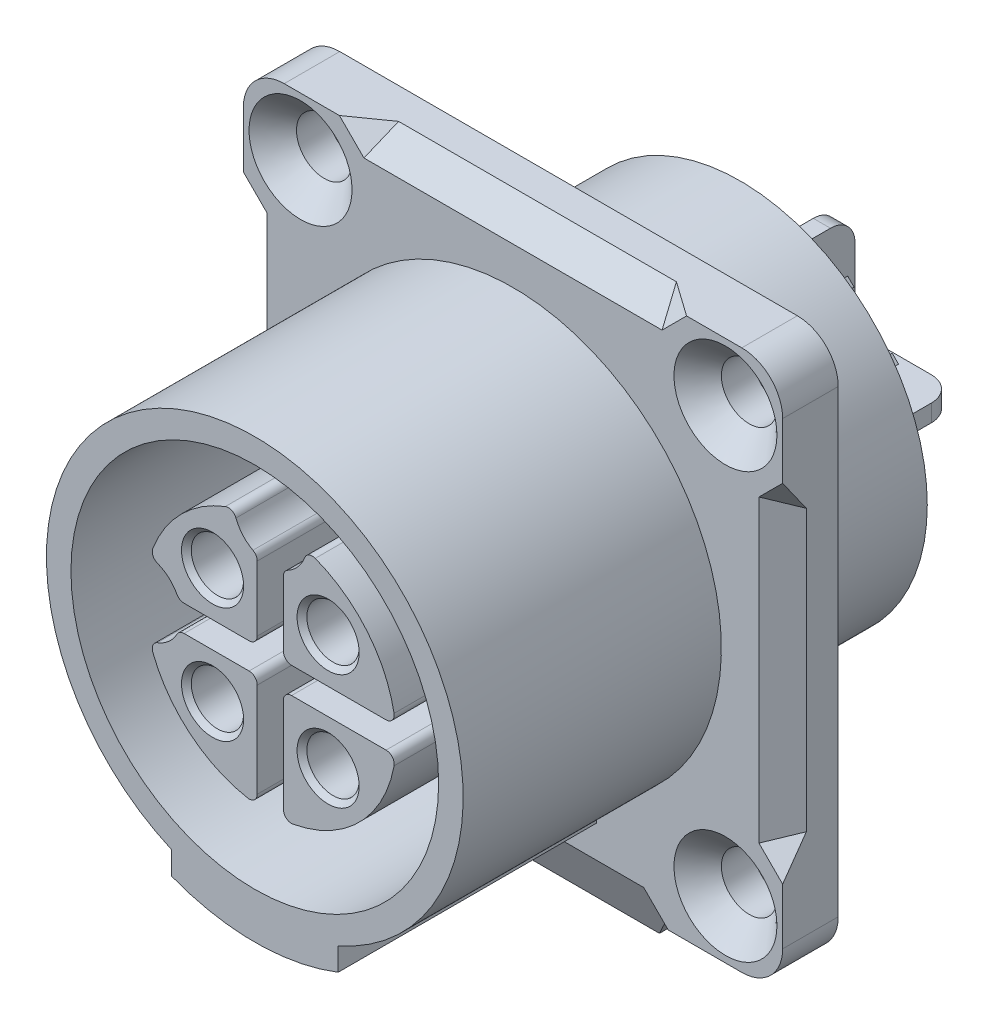
from build123d import *

# Parameters (mm, degrees)
BOSS_EXTRUDE1_DEPTH                             = 3.4
SKETCH2_R                                       = 11.25
BOSS_EXTRUDE2_DEPTH                             = 15.8
SKETCH3_R                                       = 1.6
BOSS_EXTRUDE3_DEPTH                             = 14.85
CHAMFER1_SIZE                                   = 0.3
FILLET1_R                                       = 0.5
SKETCH4_W                                       = 7.55
SKETCH4_H                                       = 14
SKETCH4_W_2                                     = 1.45
SKETCH4_W_3                                     = 14
SKETCH4_H_2                                     = 1.5
SKETCH4_H_3                                     = 7.5
CUT_EXTRUDE1_DEPTH                              = 1.5
CUT_EXTRUDE2_START                              = 1.1
CUT_EXTRUDE2_DEPTH                              = 2.3
CHAMFER2_SIZE                                   = 1.5
CHAMFER4_SIZE                                   = 1.5
CHAMFER6_SIZE                                   = 2.3
CHAMFER3_SIZE                                   = 1.5
CHAMFER5_SIZE                                   = 2.3
CHAMFER5_SIZE_2                                 = 4.32567087
CSK_FOR_M3_FLAT_HEAD_MACHINE_SCREW1_D           = 3.4
CSK_FOR_M3_FLAT_HEAD_MACHINE_SCREW1_CSINK_D     = 6.3
CSK_FOR_M3_FLAT_HEAD_MACHINE_SCREW1_CSINK_ANGLE = 90
FILLET2_R                                       = 2.5
SKETCH8_R                                       = 11.45
SKETCH8_R_2                                     = 10.25
BOSS_EXTRUDE4_DEPTH                             = 10.5
SKETCH9_R                                       = 10.25
BOSS_EXTRUDE5_DEPTH                             = 6.6
SKETCH10_R                                      = 7.75
BOSS_EXTRUDE6_DEPTH                             = 1.1
SKETCH11_W                                      = 1.05
SKETCH11_H                                      = 13.4
SKETCH11_W_2                                    = 13.4
SKETCH11_H_2                                    = 1.05
EXTRUDE_THIN1_DEPTH                             = 9.3
FILLET3_R                                       = 1.5
SKETCH12_R                                      = 2.2
SKETCH12_R_2                                    = 1.65
BOSS_EXTRUDE7_DEPTH                             = 7.4
CIRPATTERN1_COUNT                               = 4


# Read off the part's stored shape, not the designer's step: Cut-Extrude2
# Some blends are built 0.0001 mm under size
with BuildPart() as part:
    # Sketch1 → Boss-Extrude1 (new body)
    with BuildSketch(Plane.XY):
        Polygon((8.75, -16.55), (6.75, -19.21), (-6.75, -19.21), (-8.75, -16.55), (-16.5, -16.55), (-16.5, 16.55), (16.5, 16.55), (16.5, -16.55), align=None)
    extrude(amount=BOSS_EXTRUDE1_DEPTH)

    # Sketch2 → Boss-Extrude2 (add)
    with BuildSketch(Plane.XY.offset(3.4)):
        with BuildLine():
            Line((5.1, -13.091695841), (5.1, -11.685568022))
            ThreePointArc((5.1, -11.685568022), (0, 12.75), (-5.1, -11.685568022))
            Line((-5.1, -11.685568022), (-5.1, -13.091695841))
            ThreePointArc((-5.1, -13.091695841), (0, -14.05), (5.1, -13.091695841))
        make_face()
        Circle(SKETCH2_R, mode=Mode.SUBTRACT)
    extrude(amount=BOSS_EXTRUDE2_DEPTH)

    # Sketch3 → Boss-Extrude3 (add)
    # profile 1 of 4: a face of its own
    with BuildSketch(Plane.XY.offset(3.4)):
        with BuildLine():
            Line((-0.8, 0.8), (-0.8, 5.597025916))
            ThreePointArc((-0.8, 5.597025916), (-1.753833809, 6.290543733), (-2.225855815, 7.371266234))
            ThreePointArc((-2.225855815, 7.371266234), (-5.444722215, 5.444722215), (-7.371266234, 2.225855815))
            ThreePointArc((-7.371266234, 2.225855815), (-6.290543733, 1.753833809), (-5.597025916, 0.8))
            Line((-5.597025916, 0.8), (-0.8, 0.8))
        make_face()
        with Locations((-3.535533906, 3.535533906)):
            Circle(SKETCH3_R, mode=Mode.SUBTRACT)
    # profile 2 of 4: a face of its own
    with BuildSketch(Plane.XY.offset(3.4)):
        with BuildLine():
            ThreePointArc((2.225855815, 7.371266234), (1.753833809, 6.290543733), (0.8, 5.597025916))
            Line((0.8, 5.597025916), (0.8, 0.8))
            Line((0.8, 0.8), (7.658328799, 0.8))
            ThreePointArc((7.658328799, 0.8), (5.934615519, 4.906153141), (2.225855815, 7.371266234))
        make_face()
        with Locations((3.535533906, 3.535533906)):
            Circle(SKETCH3_R, mode=Mode.SUBTRACT)
    # profile 3 of 4: a face of its own
    with BuildSketch(Plane.XY.offset(3.4)):
        with BuildLine():
            Line((7.658328799, -0.8), (0.8, -0.8))
            Line((0.8, -0.8), (0.8, -7.658328799))
            ThreePointArc((0.8, -7.658328799), (5.444722215, -5.444722215), (7.658328799, -0.8))
        make_face()
        with Locations((3.535533906, -3.535533906)):
            Circle(SKETCH3_R, mode=Mode.SUBTRACT)
    # profile 4 of 4: a face of its own
    with BuildSketch(Plane.XY.offset(3.4)):
        with BuildLine():
            Line((-0.8, -7.658328799), (-0.8, -0.8))
            Line((-0.8, -0.8), (-5.597025916, -0.8))
            ThreePointArc((-5.597025916, -0.8), (-6.290543733, -1.753833809), (-7.371266234, -2.225855815))
            ThreePointArc((-7.371266234, -2.225855815), (-4.906153141, -5.934615519), (-0.8, -7.658328799))
        make_face()
        with Locations((-3.535533906, -3.535533906)):
            Circle(SKETCH3_R, mode=Mode.SUBTRACT)
    extrude(amount=BOSS_EXTRUDE3_DEPTH)

    # Chamfer1
    chamfer1_edges = [part.edges().sort_by_distance(p)[0] for p in [
        (-5.135533906, 3.535533906, 18.25),
        (1.935533906, 3.535533906, 18.25),
        (1.935533906, -3.535533906, 18.25),
        (-5.135533906, -3.535533906, 18.25),
    ]]
    chamfer(chamfer1_edges, length=CHAMFER1_SIZE)

    # Fillet1
    fillet1_edges = [part.edges().sort_by_distance(p)[0] for p in [
        (-7.371266234, 2.225855815, 10.825),
        (-5.597025916, 0.8, 10.825),
        (-0.8, 0.8, 10.825),
        (-0.8, 5.597025916, 10.825),
        (-2.225855815, 7.371266234, 10.825),
        (2.225855815, 7.371266234, 10.825),
        (0.8, 5.597025916, 10.825),
        (0.8, 0.8, 10.825),
        (7.658328799, 0.8, 10.825),
        (0.8, -0.8, 10.825),
        (0.8, -7.658328799, 10.825),
        (7.658328799, -0.8, 10.825),
        (-5.597025916, -0.8, 10.825),
        (-7.371266234, -2.225855815, 10.825),
        (-0.8, -7.658328799, 10.825),
        (-0.8, -0.8, 10.825),
    ]]
    fillet(fillet1_edges, radius=FILLET1_R)

    # Sketch4 → Cut-Extrude1 (cut)
    with BuildSketch(Plane.XY.offset(3.4)):
        with Locations((-20.275, 0)):
            Rectangle(SKETCH4_W, SKETCH4_H)
        with Locations((-15.775, 0)):
            Rectangle(SKETCH4_W_2, SKETCH4_H)
        with Locations((0, 15.8)):
            Rectangle(SKETCH4_W_3, SKETCH4_H_2)
        with Locations((0, 20.3)):
            Rectangle(SKETCH4_W_3, SKETCH4_H_3)
        with Locations((20.275, 0)):
            Rectangle(SKETCH4_W, SKETCH4_H)
        with Locations((15.775, 0)):
            Rectangle(SKETCH4_W_2, SKETCH4_H)
    extrude(amount=-CUT_EXTRUDE1_DEPTH, mode=Mode.SUBTRACT)

    # Cut-Extrude2 outline → Cut-Extrude2 (cut)
    with BuildSketch(Plane.XY.offset(CUT_EXTRUDE2_START)):
        Polygon((8, -15.05), (-8, -15.05), (-9.5, -16.55), (-8.75, -16.55), (-6.75, -19.21), (6.75, -19.21), (8.75, -16.55), (9.5, -16.55), align=None)
    extrude(amount=CUT_EXTRUDE2_DEPTH, mode=Mode.SUBTRACT)

    # Chamfer2
    # the kernel refuses this chamfer: 1.5 mm, written as the material it takes off along each edge
    with BuildSketch(Plane(origin=(7, 16.55, 7.257524482), x_dir=(0.9996219169112965, 0.02749587661058676, 0), z_dir=(0, 0, -1)), Plane(origin=(-7, 16.55, 1.9), x_dir=(-0.9996219169112965, 0.02749587661058676, 0), z_dir=(0, 0, 1))) as chamfer2_piece_1:
        Polygon((CHAMFER2_SIZE * 0.999621916911, CHAMFER2_SIZE * 0.0274958766106), (-CHAMFER2_SIZE * 0.0274958766106, CHAMFER2_SIZE * 0.999621916911), (0, 0), align=None)
    extrude(amount=5.357524482, mode=Mode.SUBTRACT)
    with BuildSketch(Plane(origin=(16.5, -7, 7.257524482), x_dir=(0.027495876610586768, -0.9996219169112968, 0), z_dir=(0, 0, -1))) as chamfer2_piece_2_section:
        Polygon((CHAMFER2_SIZE * 0.999621916911, CHAMFER2_SIZE * 0.0274958766106), (-CHAMFER2_SIZE * 0.0274958766106, CHAMFER2_SIZE * 0.999621916911), (0, 0), align=None)
    chamfer2_piece_2 = extrude(amount=5.357524482, mode=Mode.PRIVATE)
    chamfer2_piece_2 = split(chamfer2_piece_2, bisect_by=Plane(origin=(15.05, -7.500537634, 2.65), z_dir=(1, 0, 0)), keep=Keep.TOP, mode=Mode.PRIVATE)
    add(chamfer2_piece_2, mode=Mode.SUBTRACT)
    with BuildSketch(Plane(origin=(16.5, 7, 1.9), x_dir=(0.027495876610586768, 0.9996219169112968, 0), z_dir=(0, 0, 1))) as chamfer2_piece_3_section:
        Polygon((CHAMFER2_SIZE * 0.999621916911, CHAMFER2_SIZE * 0.0274958766106), (-CHAMFER2_SIZE * 0.0274958766106, CHAMFER2_SIZE * 0.999621916911), (0, 0), align=None)
    chamfer2_piece_3 = extrude(amount=5.357524482, mode=Mode.PRIVATE)
    chamfer2_piece_3 = split(chamfer2_piece_3, bisect_by=Plane(origin=(15.05, 7.500537634, 2.65), z_dir=(1, 0, 0)), keep=Keep.TOP, mode=Mode.PRIVATE)
    add(chamfer2_piece_3, mode=Mode.SUBTRACT)
    with BuildSketch(Plane(origin=(-16.5, -7, 1.9), x_dir=(-0.027495876610586768, -0.9996219169112968, 0), z_dir=(0, 0, 1))) as chamfer2_piece_4_section:
        Polygon((CHAMFER2_SIZE * 0.999621916911, CHAMFER2_SIZE * 0.0274958766106), (-CHAMFER2_SIZE * 0.0274958766106, CHAMFER2_SIZE * 0.999621916911), (0, 0), align=None)
    chamfer2_piece_4 = extrude(amount=5.357524482, mode=Mode.PRIVATE)
    chamfer2_piece_4 = split(chamfer2_piece_4, bisect_by=Plane(origin=(-15.05, -7.500537634, 2.65), z_dir=(-1, 0, 0)), keep=Keep.TOP, mode=Mode.PRIVATE)
    add(chamfer2_piece_4, mode=Mode.SUBTRACT)
    with BuildSketch(Plane(origin=(-16.5, 7, 7.257524482), x_dir=(-0.027495876610586768, 0.9996219169112968, 0), z_dir=(0, 0, -1))) as chamfer2_piece_5_section:
        Polygon((CHAMFER2_SIZE * 0.999621916911, CHAMFER2_SIZE * 0.0274958766106), (-CHAMFER2_SIZE * 0.0274958766106, CHAMFER2_SIZE * 0.999621916911), (0, 0), align=None)
    chamfer2_piece_5 = extrude(amount=5.357524482, mode=Mode.PRIVATE)
    chamfer2_piece_5 = split(chamfer2_piece_5, bisect_by=Plane(origin=(-15.05, 7.500537634, 2.65), z_dir=(-1, 0, 0)), keep=Keep.TOP, mode=Mode.PRIVATE)
    add(chamfer2_piece_5, mode=Mode.SUBTRACT)

    # Chamfer4
    chamfer4_edges = [part.edges().sort_by_distance(p)[0] for p in [
        (-7.75, 15.8, 3.4),
        (7.75, 15.8, 3.4),
        (15.775, 7.775, 3.4),
        (15.775, -7.775, 3.4),
        (-15.775, -7.775, 3.4),
        (-15.775, 7.775, 3.4),
    ]]
    chamfer(chamfer4_edges, length=CHAMFER4_SIZE - 0.0001)  # a hair under: the kernel refuses the full size

    # Chamfer6
    chamfer6_edges = [part.edges().sort_by_distance(p)[0] for p in [
        (8.75, -15.8, 1.1),
        (-8.75, -15.8, 1.1),
    ]]
    chamfer(chamfer6_edges, length=CHAMFER6_SIZE - 0.0001)  # a hair under: the kernel refuses the full size

    # Chamfer3
    # the kernel refuses this chamfer: 1.5 mm, written as the material it adds along each edge
    with BuildSketch(Plane(origin=(-10.857524482, 15.05, 1.9), x_dir=(0, -0.027495876610586775, 0.9996219169112968), z_dir=(1, 0, 0))) as chamfer3_piece_1_section:
        Polygon((CHAMFER3_SIZE * 0.999621916911, -CHAMFER3_SIZE * 0.0274958766106), (-CHAMFER3_SIZE * 0.0274958766106, -CHAMFER3_SIZE * 0.999621916911), (0, 0), align=None)
    chamfer3_piece_1 = extrude(amount=21.715048964, mode=Mode.PRIVATE)
    chamfer3_piece_1 = split(chamfer3_piece_1, bisect_by=Plane(origin=(-9.154722825, 15.501921168, 3.4), z_dir=(0, 0, -1)), keep=Keep.TOP, mode=Mode.PRIVATE)
    chamfer3_piece_1 = split(chamfer3_piece_1, bisect_by=Plane(origin=(-9.154722825, 16.55, 2.416093699), z_dir=(0, -1, 0)), keep=Keep.TOP, mode=Mode.PRIVATE)
    add(chamfer3_piece_1)
    with BuildSketch(Plane(origin=(15.05, -10.907524482, 1.9), x_dir=(-0.027495876610586775, 0, 0.9996219169112968), z_dir=(0, 1, 0))) as chamfer3_piece_2_section:
        Polygon((CHAMFER3_SIZE * 0.999621916911, CHAMFER3_SIZE * 0.0274958766106), (-CHAMFER3_SIZE * 0.0274958766106, CHAMFER3_SIZE * 0.999621916911), (0, 0), align=None)
    chamfer3_piece_2 = extrude(amount=21.815048964, mode=Mode.PRIVATE)
    chamfer3_piece_2 = split(chamfer3_piece_2, bisect_by=Plane(origin=(15.4992149, -9.203369691, 3.4), z_dir=(0, 0, -1)), keep=Keep.TOP, mode=Mode.PRIVATE)
    chamfer3_piece_2 = split(chamfer3_piece_2, bisect_by=Plane(origin=(16.5, -9.203369691, 2.417514382), z_dir=(-1, 0, 0)), keep=Keep.TOP, mode=Mode.PRIVATE)
    add(chamfer3_piece_2)
    with BuildSketch(Plane(origin=(-15.05, 10.907524482, 1.9), x_dir=(0.027495876610586775, 0, 0.9996219169112968), z_dir=(0, -1, 0))) as chamfer3_piece_3_section:
        Polygon((CHAMFER3_SIZE * 0.999621916911, CHAMFER3_SIZE * 0.0274958766106), (-CHAMFER3_SIZE * 0.0274958766106, CHAMFER3_SIZE * 0.999621916911), (0, 0), align=None)
    chamfer3_piece_3 = extrude(amount=21.815048964, mode=Mode.PRIVATE)
    chamfer3_piece_3 = split(chamfer3_piece_3, bisect_by=Plane(origin=(-15.4992149, 9.203369691, 3.4), z_dir=(0, 0, -1)), keep=Keep.TOP, mode=Mode.PRIVATE)
    chamfer3_piece_3 = split(chamfer3_piece_3, bisect_by=Plane(origin=(-16.5, 9.203369691, 2.417514382), z_dir=(1, 0, 0)), keep=Keep.TOP, mode=Mode.PRIVATE)
    add(chamfer3_piece_3)

    # Chamfer5
    # the kernel refuses this chamfer: 4.32567087, 2.3 mm, written as the material it adds along each edge
    with BuildSketch(Plane(origin=(15.94540306, -15.05, 1.1), x_dir=(0, 0.06402577567608216, 0.9979482451756083), z_dir=(-1, 0, 0))) as chamfer5_piece_1_section:
        Polygon((CHAMFER5_SIZE * 0.997948245176, -CHAMFER5_SIZE * 0.0640257756761), (-CHAMFER5_SIZE_2 * 0.0640257756805, -CHAMFER5_SIZE_2 * 0.997948245244), (0, 0), align=None)
    chamfer5_piece_1 = extrude(amount=31.890806121, mode=Mode.PRIVATE)
    chamfer5_piece_1 = split(chamfer5_piece_1, bisect_by=Plane(origin=(7.931232442, -15.75270392, 3.4), z_dir=(0, 0, -1)), keep=Keep.TOP, mode=Mode.PRIVATE)
    chamfer5_piece_1 = split(chamfer5_piece_1, bisect_by=Plane(origin=(-3.108471359, -24.053233093, 1.85154137), z_dir=(0.7992782688277338, 0.6009611043817571, 0)), keep=Keep.TOP, mode=Mode.PRIVATE)
    chamfer5_piece_1 = split(chamfer5_piece_1, bisect_by=Plane(origin=(8.83726795, -16.433933626, 1.85154137), z_dir=(-0.7992782688277347, 0.6009611043817559, 0)), keep=Keep.TOP, mode=Mode.PRIVATE)
    chamfer5_piece_1 = split(chamfer5_piece_1, bisect_by=Plane(origin=(7.931232442, -19.21, 1.85154137), z_dir=(0, 1, 0)), keep=Keep.TOP, mode=Mode.PRIVATE)
    add(chamfer5_piece_1)

    # CSK for M3 Flat Head Machine Screw1 (through all)
    with Locations(Plane.XY.offset(3.4)):
        with Locations((-13, 13), (13, 13), (13, -13), (-13, -13)):
            CounterSinkHole(CSK_FOR_M3_FLAT_HEAD_MACHINE_SCREW1_D / 2, CSK_FOR_M3_FLAT_HEAD_MACHINE_SCREW1_CSINK_D / 2, counter_sink_angle=CSK_FOR_M3_FLAT_HEAD_MACHINE_SCREW1_CSINK_ANGLE)

    # Fillet2
    fillet2_edges = [part.edges().sort_by_distance(p)[0] for p in [
        (16.5, -16.55, 1.7),
        (-16.5, -16.55, 1.7),
        (-16.5, 16.55, 1.7),
        (16.5, 16.55, 1.7),
    ]]
    fillet(fillet2_edges, radius=FILLET2_R)

    # Sketch8 → Boss-Extrude4 (add)
    with BuildSketch(Plane(origin=(0, 0, 0), x_dir=(-1, 0, 0), z_dir=(0, 0, -1))):
        with Locations(Location((0, 0, 0), (0, 0, 180))):
            Circle(SKETCH8_R)
        with Locations(Location((0, 0, 0), (0, 0, 180))):
            Circle(SKETCH8_R_2, mode=Mode.SUBTRACT)
    extrude(amount=BOSS_EXTRUDE4_DEPTH)

    # Sketch9 → Boss-Extrude5 (add)
    with BuildSketch(Plane(origin=(0, 0, 0), x_dir=(-1, 0, 0), z_dir=(0, 0, -1))):
        with Locations(Location((0, 0, 0), (0, 0, 180))):
            Circle(SKETCH9_R)
    extrude(amount=BOSS_EXTRUDE5_DEPTH)

    # Sketch10 → Boss-Extrude6 (add)
    with BuildSketch(Plane(origin=(0, 0, -6.6), x_dir=(-1, 0, 0), z_dir=(0, 0, -1))):
        Circle(SKETCH10_R)
    extrude(amount=BOSS_EXTRUDE6_DEPTH)

    # Sketch11 → Extrude-Thin1 (add)
    with BuildSketch(Plane(origin=(0, 0, -7.7), x_dir=(-1, 0, 0), z_dir=(0, 0, -1))):
        Rectangle(SKETCH11_W, SKETCH11_H)
        Rectangle(SKETCH11_W_2, SKETCH11_H_2)
    extrude(amount=EXTRUDE_THIN1_DEPTH)

    # Fillet3
    fillet3_edges = [part.edges().sort_by_distance(p)[0] for p in [
        (0, 6.7, -17),
        (0, -6.7, -17),
        (6.7, 0, -17),
        (-6.7, 0, -17),
    ]]
    fillet(fillet3_edges, radius=FILLET3_R)

    # Sketch12 → Boss-Extrude7 (add)
    with BuildSketch(Plane(origin=(0, 0, -7.7), x_dir=(-1, 0, 0), z_dir=(0, 0, -1))):
        with Locations(Location((-3.535533906, 3.535533906, 0), (0, 0, 180))):
            Circle(SKETCH12_R)
        with Locations(Location((-3.535533906, 3.535533906, 0), (0, 0, 180))):
            Circle(SKETCH12_R_2, mode=Mode.SUBTRACT)
    boss_extrude7 = extrude(amount=BOSS_EXTRUDE7_DEPTH)

    # Sketch13 → Cut-Revolve1 (revolve, cut)
    with BuildSketch(Plane(origin=(0, 0, -15.1), x_dir=(-1, 0, 0), z_dir=(0, 0, -1))):
        Polygon((-6.646803743, 3.535533906), (-3.535533906, 6.646803743), (-1.979898987, 5.091168825), (-5.091168825, 1.979898987), align=None)
    cut_revolve1 = revolve(axis=Axis((6.646803743, 3.535533906, -15.1), (-0.7071067811865511, 0.707106781186544, 0)), mode=Mode.SUBTRACT)

    # CirPattern1: Boss-Extrude7, Cut-Revolve1 ×4 about axis
    cirpattern1_axis = Axis((0, 0, 0), (0, 0, 1))
    add([boss_extrude7.rotate(cirpattern1_axis, i * 360 / CIRPATTERN1_COUNT) for i in range(1, CIRPATTERN1_COUNT)])
    add([cut_revolve1.rotate(cirpattern1_axis, i * 360 / CIRPATTERN1_COUNT) for i in range(1, CIRPATTERN1_COUNT)], mode=Mode.SUBTRACT)


solid = part.part
